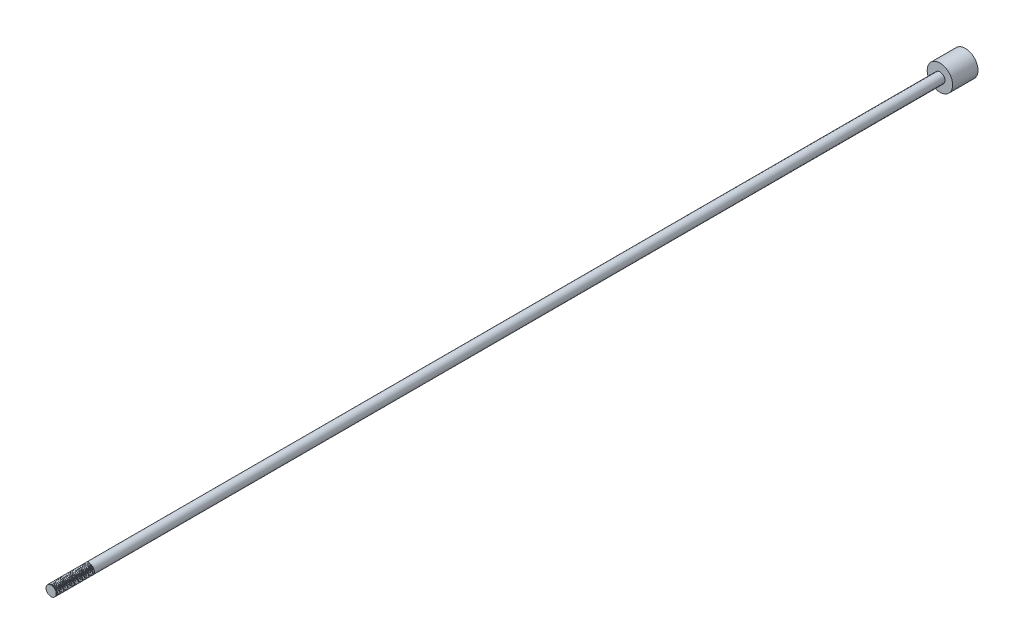
from build123d import *

# Parameters (mm, degrees)
SKETCH_1_R      = 5
EXTRUDE_1_DEPTH = 10
SKETCH_2_R      = 2
EXTRUDE_2_DEPTH = 350
THREAD_1_PITCH  = 0.3175


with BuildPart() as part:
    # Sketch 1 → 凸台-拉伸1 (new body)
    with BuildSketch(Plane.XY):
        Circle(SKETCH_1_R)
    extrude(amount=EXTRUDE_1_DEPTH)

    # 草图2 → 凸台-拉伸2 (add)
    with BuildSketch(Plane.XY.offset(10)):
        Circle(SKETCH_2_R)
    extrude(amount=EXTRUDE_2_DEPTH)

    # 螺纹线1: the profile of Sketch 1 2 profile screwed along a right-hand helix of 47.244094 turns, 6 arcs to a turn; built about Z, then put on its axis
    thread_1_z = Axis((0, 0, 0), (0, 0, 1))
    thread_1_corners = [(2.0003, 0, -0.000173205), (2.0003, 0, 0.277985704), (1.828148085, 0, 0.17859375), (1.828148085, 0, 0.09921875)]
    with BuildLine(mode=Mode.PRIVATE) as thread_1_profile:
        Line(thread_1_corners[0], thread_1_corners[1])
        Line(thread_1_corners[1], thread_1_corners[2])
        Line(thread_1_corners[2], thread_1_corners[3])
        Line(thread_1_corners[3], thread_1_corners[0])
    thread_1_cap = Face(thread_1_profile.wire())
    thread_1_turn_angles = [0, 30, 60, 90, 120, 150, 180, 210, 240, 270, 300, 330, 360, 390, 420, 450, 480, 510, 540, 570, 600, 630, 660, 690, 720]
    thread_1_turn_weights = [1, 0.8660254037844387, 1, 0.8660254037844387, 1, 0.8660254037844387, 1, 0.8660254037844387, 1, 0.8660254037844387, 1, 0.8660254037844387, 1, 0.8660254037844387, 1, 0.8660254037844387, 1, 0.8660254037844387, 1, 0.8660254037844387, 1, 0.8660254037844387, 1, 0.8660254037844387, 1]
    thread_1_turn_rails = [Edge.make_bspline([Vector(p[0], p[1], 0).rotate(thread_1_z, thread_1_turn_angles[k]) / thread_1_turn_weights[k] + Vector(0, 0, p[2] + THREAD_1_PITCH * thread_1_turn_angles[k] / 360) for k in range(25)], [0, 0, 0, 1, 1, 2, 2, 3, 3, 4, 4, 5, 5, 6, 6, 7, 7, 8, 8, 9, 9, 10, 10, 11, 11, 12, 12, 12], 2, thread_1_turn_weights) for p in thread_1_corners]
    thread_1_turn_sides = [Face.make_surface_from_curves(thread_1_turn_rails[p[0]], thread_1_turn_rails[p[1]]) for p in [(0, 1), (1, 2), (2, 3), (3, 0)]]
    thread_1_last_angles = [16560, 16590, 16620, 16650, 16680, 16710, 16740, 16770, 16800, 16830, 16860, 16890, 16920, 16950, 16980, 16993.937007874, 17007.874015748]
    thread_1_last_weights = [1, 0.8660254037844387, 1, 0.8660254037844387, 1, 0.8660254037844387, 1, 0.8660254037844387, 1, 0.8660254037844387, 1, 0.8660254037844387, 1, 0.8660254037844387, 1, 0.9705611135832078, 1]
    thread_1_last_rails = [Edge.make_bspline([Vector(p[0], p[1], 0).rotate(thread_1_z, thread_1_last_angles[k]) / thread_1_last_weights[k] + Vector(0, 0, p[2] + THREAD_1_PITCH * thread_1_last_angles[k] / 360) for k in range(17)], [0, 0, 0, 1, 1, 2, 2, 3, 3, 4, 4, 5, 5, 6, 6, 7, 7, 8, 8, 8], 2, thread_1_last_weights) for p in thread_1_corners]
    thread_1_last_sides = [Face.make_surface_from_curves(thread_1_last_rails[p[0]], thread_1_last_rails[p[1]]) for p in [(0, 1), (1, 2), (2, 3), (3, 0)]]
    thread_1 = Plane(origin=(0, 0, 360), x_dir=(-1, 0, 0), z_dir=(0, 0, -1)) * Solid(Shell([*[p.moved(Location((0, 0, 2 * THREAD_1_PITCH * i))) for i in range(23) for p in thread_1_turn_sides], *thread_1_last_sides, thread_1_cap, thread_1_cap.rotate(thread_1_z, 17007.874015748).moved(Location((0, 0, THREAD_1_PITCH * 17007.874015748 / 360)))]))
    add(thread_1, mode=Mode.SUBTRACT)


solid = part.part
